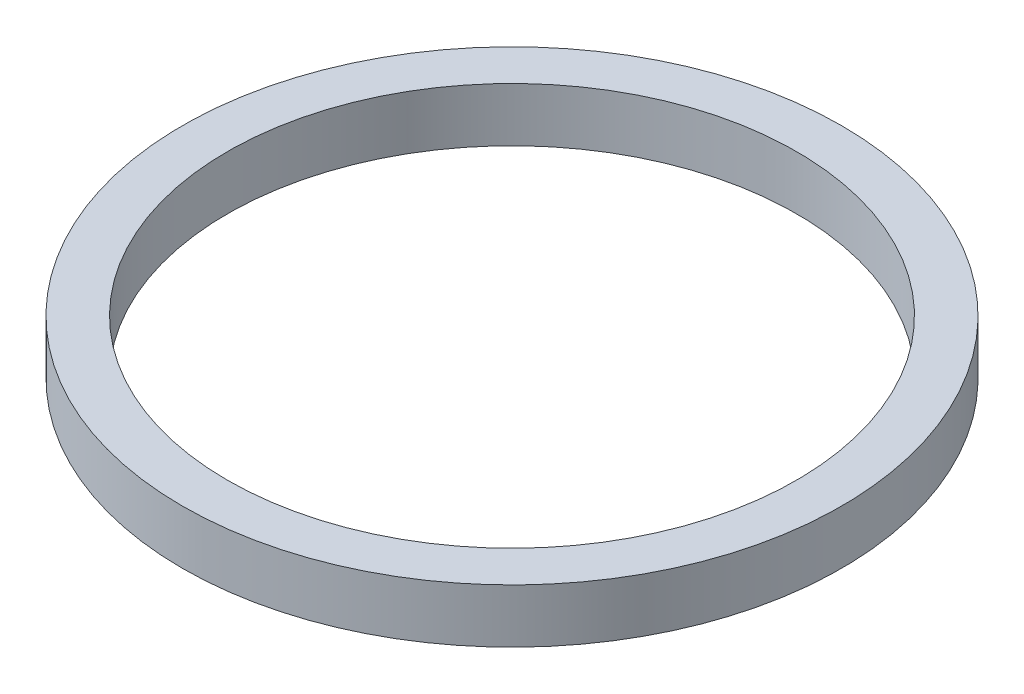
from build123d import *

# Parameters (mm, degrees)
SKETCH1_R           = 55
BOSS_EXTRUDE1_DEPTH = 9
SKETCH2_R           = 47.5
CUT_EXTRUDE1_DEPTH  = 79.300702423


with BuildPart() as part:
    # Sketch1 → Boss-Extrude1 (new body)
    with BuildSketch(Plane(origin=(0, 0, 0), x_dir=(1, 0, 0), z_dir=(0, 1, 0))):
        Circle(SKETCH1_R)
    extrude(amount=BOSS_EXTRUDE1_DEPTH)

    # Sketch2 → Cut-Extrude1 (cut, through all)
    with BuildSketch(Plane(origin=(0, 0, 0), x_dir=(1, 0, 0), z_dir=(0, 1, 0))):
        Circle(SKETCH2_R)
    extrude(amount=CUT_EXTRUDE1_DEPTH, mode=Mode.SUBTRACT)


solid = part.part
